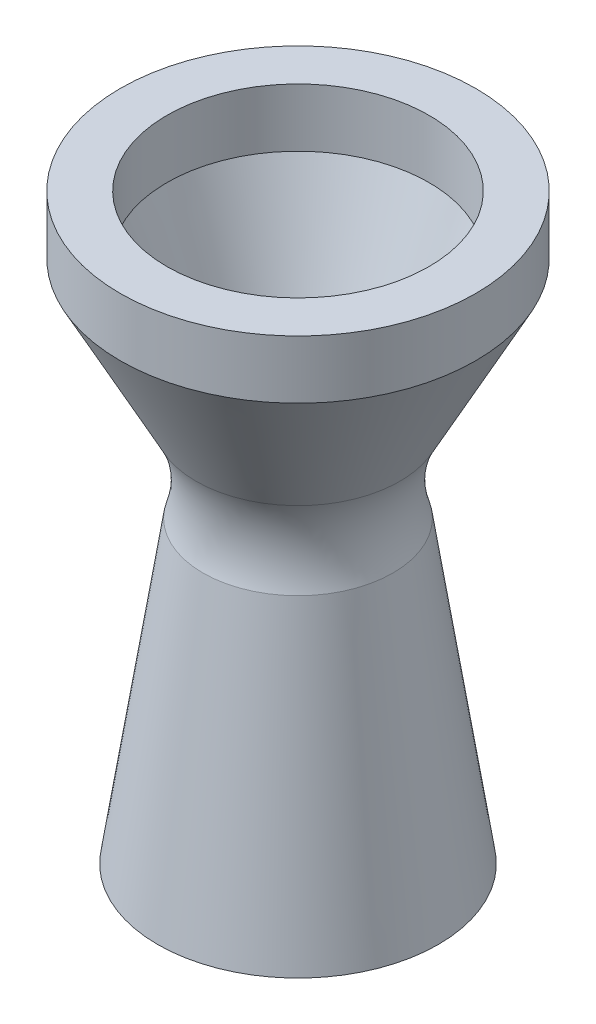
from build123d import *

# Parameters (mm, degrees)
SKETCH1_R           = 30.5
SKETCH1_R_2         = 22.5
BOSS_EXTRUDE1_DEPTH = 10


with BuildPart() as part:
    # Sketch1 → Boss-Extrude1 (new body)
    with BuildSketch(Plane(origin=(0, 0, 0), x_dir=(1, 0, 0), z_dir=(0, 1, 0))):
        Circle(SKETCH1_R)
        Circle(SKETCH1_R_2, mode=Mode.SUBTRACT)
    extrude(amount=BOSS_EXTRUDE1_DEPTH)

    # Sketch3 → Revolve1 (revolve)
    with BuildSketch(Plane.XY):
        with BuildLine():
            Line((-30.5, 0), (-17.489511795, -24.427115491))
            ThreePointArc((-17.489511795, -24.427115491), (-15.437335437, -31.410737663), (-16.318683835, -38.636084121))
            Line((-16.318683835, -38.636084121), (-24.083035566, -90))
            Line((-24.083035566, -90), (-20.583035566, -90))
            Line((-20.583035566, -90), (-11.660824612, -35.833990815))
            ThreePointArc((-11.660824612, -35.833990815), (-11.496292156, -30.229102591), (-12.820813268, -24.780480127))
            Line((-12.820813268, -24.780480127), (-22.5, 0))
            Line((-22.5, 0), (-30.5, 0))
        make_face()
    revolve(axis=Axis((0, 0, 0), (0, 1, 0)))


solid = part.part
